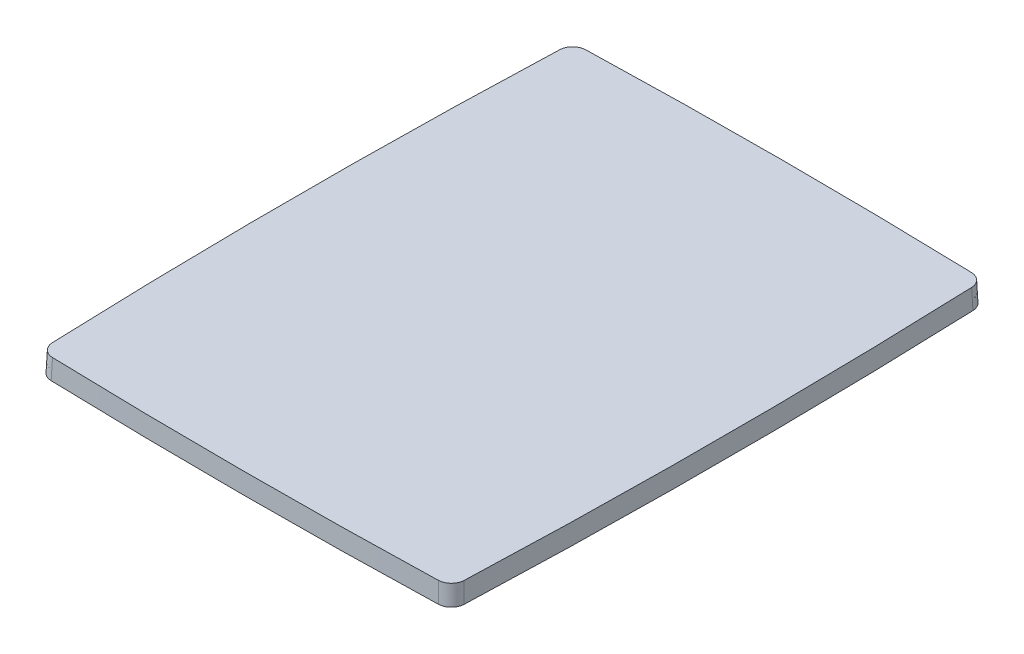
from build123d import *

# Parameters (mm, degrees)
BOSS_EXTRUDE1_DEPTH = 1.5
BOSS_EXTRUDE1_TAPER = 2
FILLET1_R           = 1


with BuildPart() as part:
    # Sketch1 → Boss-Extrude1 (new body)
    with BuildSketch(Plane(origin=(0, 0, 0), x_dir=(1, 0, 0), z_dir=(0, 1, 0))):
        with BuildLine():
            ThreePointArc((-15.398991588, 19.940901099), (-15.8, 0), (-15.398991588, -19.940901099))
            ThreePointArc((-15.398991588, -19.940901099), (0, -20.18), (15.398991588, -19.940901099))
            ThreePointArc((15.398991588, -19.940901099), (15.8, 0), (15.398991588, 19.940901099))
            ThreePointArc((15.398991588, 19.940901099), (0, 20.18), (-15.398991588, 19.940901099))
        make_face()
    extrude(amount=BOSS_EXTRUDE1_DEPTH, taper=BOSS_EXTRUDE1_TAPER)

    # Fillet1
    fillet1_edges = [part.edges().sort_by_distance(p)[0] for p in [
        (-15.373801496, 0.75, 19.915479128),
        (15.373801497, 0.75, 19.915479128),
        (15.373801496, 0.75, -19.915479128),
        (-15.373801496, 0.75, -19.915479128),
    ]]
    fillet(fillet1_edges, radius=FILLET1_R)


solid = part.part
